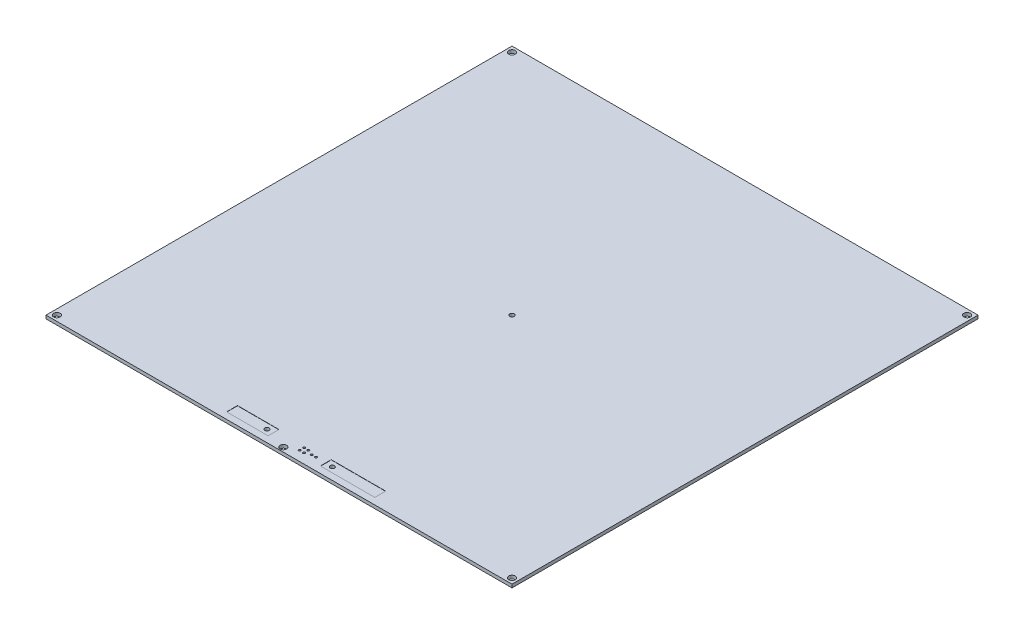
from build123d import *

# Parameters (mm, degrees)
SKIZZE1_W                       = 214
SKIZZE1_H                       = 214
AUFSATZ_LINEAR_AUSTRAGEN1_DEPTH = 1.5
SKIZZE2_R                       = 1.5
SCHNITT_LINEAR_AUSTRAGEN1_DEPTH = 152.328285525
SPIEGELN2_COPY_1_SKETCH_R       = 1.5
SPIEGELN2_COPY_1_DEPTH          = 152.328285525
SKIZZE3_R                       = 1.5
SKIZZE3_R_2                     = 1
SKIZZE3_R_3                     = 0.5
SKIZZE3_R_4                     = 1.05
SCHNITT_LINEAR_AUSTRAGEN2_DEPTH = 152.328285525
SKIZZE4_W                       = 19.050649498
SKIZZE4_H                       = 5
SKIZZE4_W_2                     = 25
SCHNITT_LINEAR_AUSTRAGEN3_DEPTH = 0.1


with BuildPart() as part:
    # Skizze1 → Aufsatz-Linear austragen1 (new body)
    with BuildSketch(Plane(origin=(0, 0, 0), x_dir=(1, 0, 0), z_dir=(0, 1, 0))):
        Rectangle(SKIZZE1_W, SKIZZE1_H)
    extrude(amount=AUFSATZ_LINEAR_AUSTRAGEN1_DEPTH)

    # Skizze2 → Schnitt-Linear austragen1 (cut, through all)
    with BuildSketch(Plane(origin=(0, 1.5, 0), x_dir=(1, 0, 0), z_dir=(0, 1, 0))):
        with Locations((-104.5, 104.5)):
            Circle(SKIZZE2_R)
    schnitt_linear_austragen1 = extrude(amount=-SCHNITT_LINEAR_AUSTRAGEN1_DEPTH, mode=Mode.SUBTRACT)

    # Spiegeln1: Schnitt-Linear austragen1 across plane
    add(schnitt_linear_austragen1.mirror(Plane.XY), mode=Mode.SUBTRACT)

    # Spiegeln2: Schnitt-Linear austragen1 across plane
    add(schnitt_linear_austragen1.mirror(Plane(origin=(0, 0, 0), x_dir=(0, 0, 1), z_dir=(1, 0, 0))), mode=Mode.SUBTRACT)

    # Spiegeln2 copy 1 sketch → Spiegeln2 copy 1 (cut, through all)
    with BuildSketch(Plane(origin=(0, 1.5, 0), x_dir=(-1, 0, 0), z_dir=(0, 1, 0))):
        with Locations((-104.5, 104.5)):
            Circle(SPIEGELN2_COPY_1_SKETCH_R)
    extrude(amount=-SPIEGELN2_COPY_1_DEPTH, mode=Mode.SUBTRACT)

    # Skizze3 → Schnitt-Linear austragen2 (cut, through all)
    with BuildSketch(Plane(origin=(0, 1.5, 0), x_dir=(1, 0, 0), z_dir=(0, 1, 0))):
        with Locations((0, -105)):
            Circle(SKIZZE3_R)
        with Locations((-11, -101.5)):
            Circle(SKIZZE3_R_2)
        with Locations((19, -101.5)):
            Circle(SKIZZE3_R_2)
        with Locations((5, -100.5)):
            Circle(SKIZZE3_R_3)
        with Locations((5, -102.5)):
            Circle(SKIZZE3_R_3)
        with Locations((7, -100.5)):
            Circle(SKIZZE3_R_3)
        with Locations((7, -102.5)):
            Circle(SKIZZE3_R_3)
        with Locations((9.5, -101.5)):
            Circle(SKIZZE3_R_3)
        with Locations((11.5, -101.5)):
            Circle(SKIZZE3_R_3)
        Circle(SKIZZE3_R_4)
    extrude(amount=-SCHNITT_LINEAR_AUSTRAGEN2_DEPTH, mode=Mode.SUBTRACT)

    # Skizze4 → Schnitt-Linear austragen3 (cut)
    with BuildSketch(Plane(origin=(0, 1.5, 0), x_dir=(1, 0, 0), z_dir=(0, 1, 0))):
        with Locations((-17.525324749, -101.5)):
            Rectangle(SKIZZE4_W, SKIZZE4_H)
        with Locations((28.5, -101.5)):
            Rectangle(SKIZZE4_W_2, SKIZZE4_H)
    extrude(amount=-SCHNITT_LINEAR_AUSTRAGEN3_DEPTH, mode=Mode.SUBTRACT)


solid = part.part
